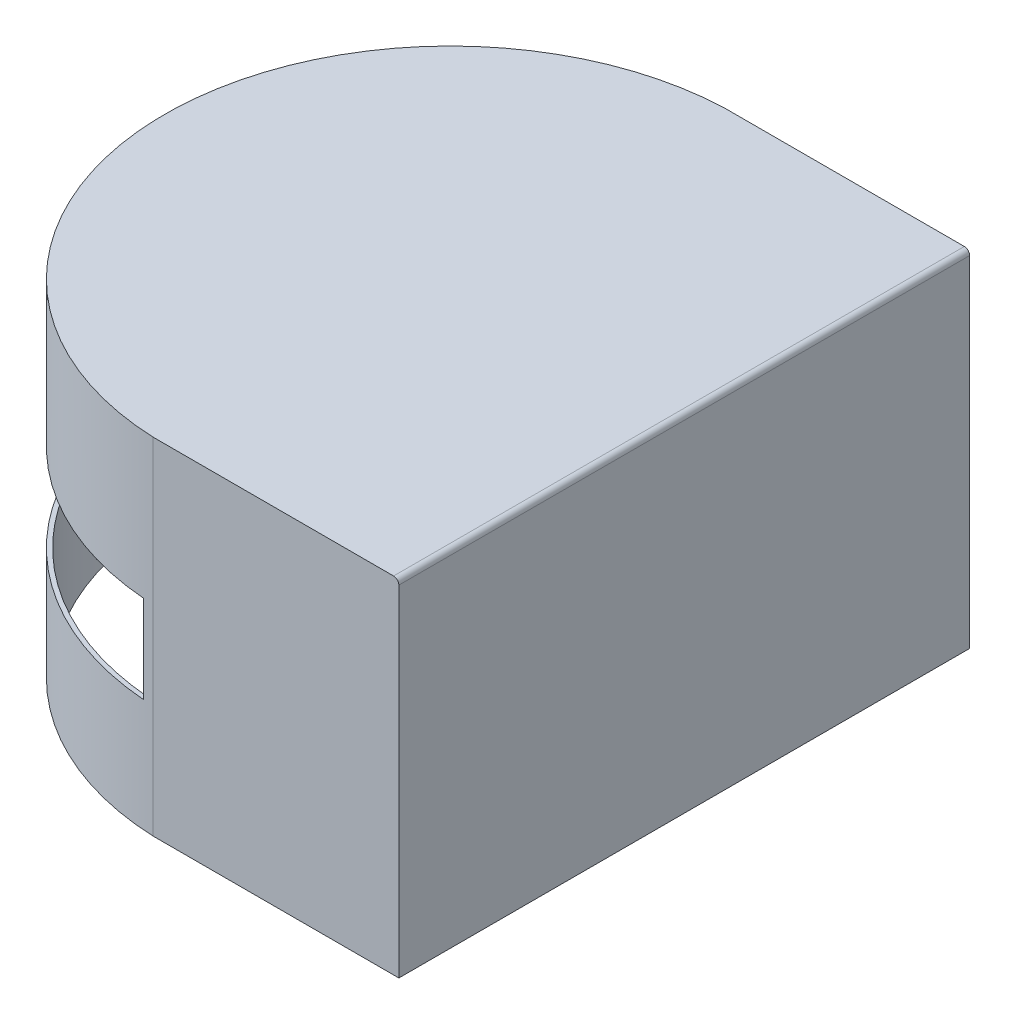
from build123d import *

# Parameters (mm, degrees)
SKETCH1_W                    = 60
SKETCH1_H                    = 65
BASE_FLANGE1_DEPTH           = 0.5
CUT_EXTRUDE1_DEPTH           = 45.232341109
EDGE_FLANGE1_STRIP_W         = 2.2
EDGE_FLANGE1_STRIP_H         = 0.5
EDGE_FLANGE1_STRIP_CUT_DEPTH = 65
EDGE_FLANGE1_DEPTH           = 65
EXTRUDE_THIN1_START          = 38.85
EXTRUDE_THIN1_DEPTH          = 38.85
SKETCH87_W                   = 65
SKETCH87_H                   = 10
CUT_EXTRUDE2_DEPTH           = 30


# Sheet-metal steps are written as plain solids
with BuildPart() as part:
    # Sketch1 → Base-Flange1 (new body)
    with BuildSketch(Plane(origin=(0, 0, 0), x_dir=(1, 0, 0), z_dir=(0, 1, 0))):
        Rectangle(SKETCH1_W, SKETCH1_H)
    extrude(amount=-BASE_FLANGE1_DEPTH)

    # Sketch7 → Cut-Extrude1 (cut, through all)
    with BuildSketch(Plane.XZ.offset(0.5)):
        with BuildLine():
            Line((2, 32.5), (-30, 32.5))
            Line((-30, 32.5), (-30, -32.5))
            Line((-30, -32.5), (2, -32.5))
            ThreePointArc((2, -32.5), (-29.169489574, 0), (2, 32.5))
        make_face()
    extrude(amount=-CUT_EXTRUDE1_DEPTH, mode=Mode.SUBTRACT)

    # Edge-Flange1 strip (across the edge) → Edge-Flange1 strip cut (cut)
    with BuildSketch(Plane(origin=(30, -0.5, -32.5), x_dir=(-1, 0, 0), z_dir=(0, 0, 1))):
        with Locations((-0.5, -0.25)):
            Rectangle(EDGE_FLANGE1_STRIP_W, EDGE_FLANGE1_STRIP_H)
    extrude(amount=EDGE_FLANGE1_STRIP_CUT_DEPTH, mode=Mode.SUBTRACT)

    # Edge-Flange1 section (across the edge) → Edge-Flange1 (add)
    with BuildSketch(Plane(origin=(30, -0.5, -32.5), x_dir=(-1, 0, 0), z_dir=(0, 0, 1))):
        with BuildLine():
            Line((0, 0.1), (0, 38.85))
            Line((0, 38.85), (0.5, 38.85))
            Line((0.5, 38.85), (0.5, 0.1))
            ThreePointArc((0.5, 0.1), (0.529289322, 0.029289322), (0.6, 0))
            Line((0.6, 0), (0.6, -0.5))
            ThreePointArc((0.6, -0.5), (0.175735931, -0.324264069), (0, 0.1))
        make_face()
    extrude(amount=EDGE_FLANGE1_DEPTH)

    # Sketch84 → Extrude-Thin1 (add)
    with BuildSketch(Plane.XZ.offset(0.5).offset(EXTRUDE_THIN1_START)):
        with BuildLine():
            Line((29.5, 32.5), (2, 32.5))
            ThreePointArc((2, 32.5), (-29.169489574, 0), (2, -32.5))
            Line((2, -32.5), (29.5, -32.5))
            Line((29.5, -32.5), (29.5, -32))
            Line((29.5, -32), (2.010489053, -32))
            ThreePointArc((2.010489053, -32), (-28.669489574, 0), (2.010489053, 32))
            Line((2.010489053, 32), (29.5, 32))
            Line((29.5, 32), (29.5, 32.5))
        make_face()
    extrude(amount=-EXTRUDE_THIN1_DEPTH)

    # Sketch87 → Cut-Extrude2 (cut)
    with BuildSketch(Plane.ZY.offset(29.169489574)):
        with Locations((0, -21.5)):
            Rectangle(SKETCH87_W, SKETCH87_H)
    extrude(amount=-CUT_EXTRUDE2_DEPTH, mode=Mode.SUBTRACT)


solid = part.part
